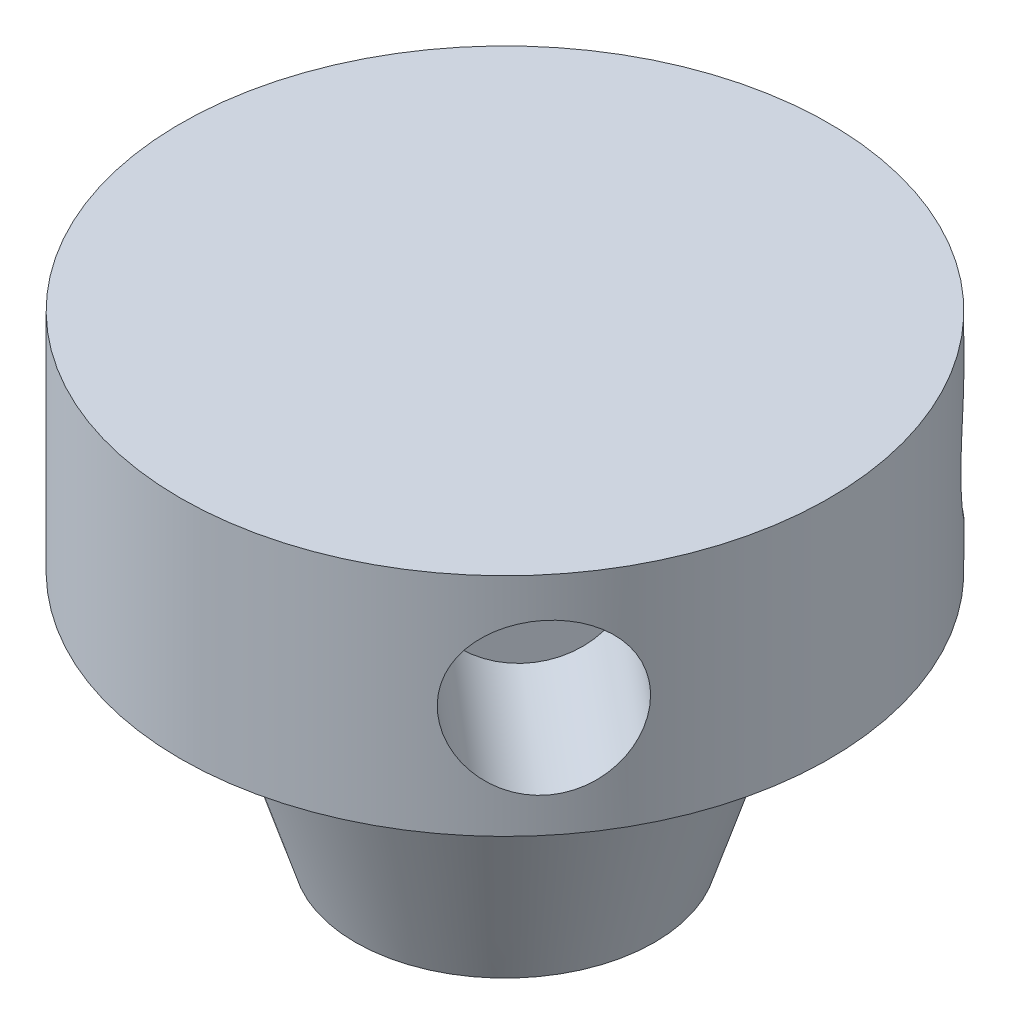
from build123d import *

# Parameters (mm, degrees)
SKETCH_2_R          = 7
CUT_EXTRUDE_1_DEPTH = 15
SKETCH_3_R          = 7
CUT_EXTRUDE_2_DEPTH = 15
SKETCH_4_R          = 7
CUT_EXTRUDE_3_DEPTH = 15
SKETCH_5_R          = 7
CUT_EXTRUDE_4_DEPTH = 15


with BuildPart() as part:
    # Эскиз1 → Повернуть1 (revolve)
    with BuildSketch(Plane.XY):
        Polygon((0, 0), (13.832956578, 0), (21.093288223, 22.779290537), (30, 22.779290537), (30, 43.652744016), (0, 43.652744016), align=None)
    revolve(axis=Axis((0, 55.269274649, 0), (0, -1, 0)))

    # Эскиз2 → Вырез-Вытянуть1 (cut)
    with BuildSketch(Plane(origin=(-30, 0, 0), x_dir=(0, 1, 0), z_dir=(-1, 0, 0))):
        with Locations((33, 0)):
            Circle(SKETCH_2_R)
    extrude(amount=-CUT_EXTRUDE_1_DEPTH, mode=Mode.SUBTRACT)

    # Эскиз3 → Вырез-Вытянуть2 (cut)
    with BuildSketch(Plane(origin=(-15, 0, -25.980762114), x_dir=(0, 1, 0), z_dir=(-0.4999999999999889, 0, -0.866025403784445))):
        with Locations((33, 0)):
            Circle(SKETCH_3_R)
    extrude(amount=-CUT_EXTRUDE_2_DEPTH, mode=Mode.SUBTRACT)

    # Эскиз4 → Вырез-Вытянуть3 (cut)
    with BuildSketch(Plane(origin=(18.46984426, 0, -23.640322608), x_dir=(0, 1, 0), z_dir=(0.6156614753256539, 0, -0.7880107536067255))):
        with Locations((33, 0)):
            Circle(SKETCH_4_R)
    extrude(amount=-CUT_EXTRUDE_3_DEPTH, mode=Mode.SUBTRACT)

    # Эскиз5 → Вырез-Вытянуть4 (cut)
    with BuildSketch(Plane(origin=(22.981333294, 0, 19.283628291), x_dir=(0, 1, 0), z_dir=(0.7660444431189749, 0, 0.642787609686543))):
        with Locations((33, 0)):
            Circle(SKETCH_5_R)
    extrude(amount=-CUT_EXTRUDE_4_DEPTH, mode=Mode.SUBTRACT)


solid = part.part
